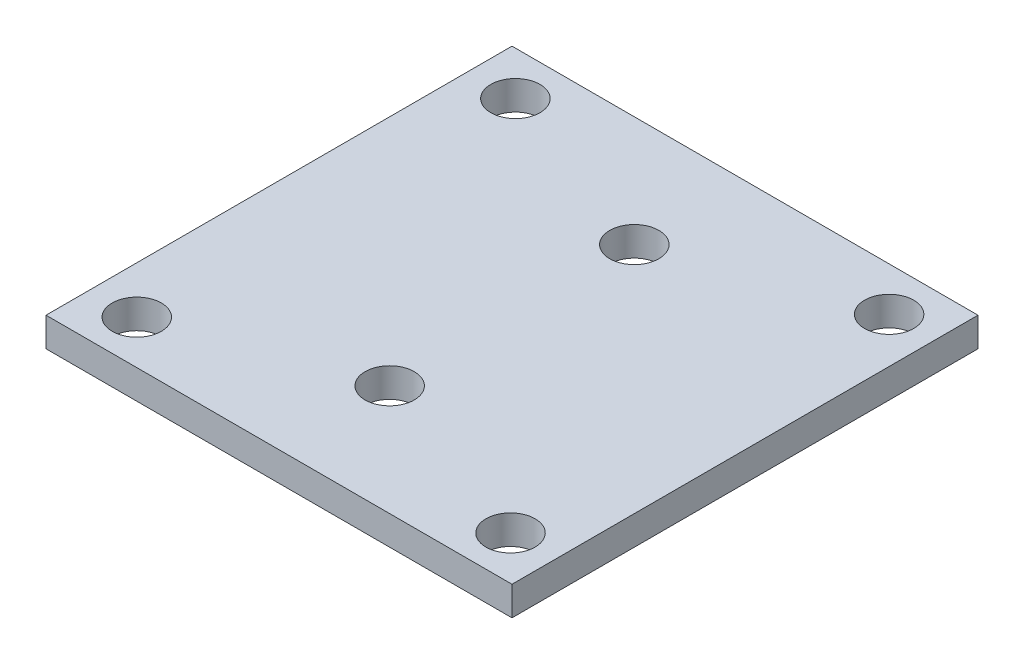
from build123d import *

# Parameters (mm, degrees)
SKETCH1_W               = 101.6
SKETCH1_H               = 101.6
BOSS_EXTRUDE1_DEPTH     = 6.35
F_1_2_13_TAPPED_HOLE1_D = 10.71626
F_1_2_13_TAPPED_HOLE2_D = 10.71626


with BuildPart() as part:
    # Sketch1 → Boss-Extrude1 (new body)
    with BuildSketch(Plane(origin=(0, 0, 0), x_dir=(1, 0, 0), z_dir=(0, 1, 0))):
        with Locations((50.8, 50.8)):
            Rectangle(SKETCH1_W, SKETCH1_H)
    extrude(amount=BOSS_EXTRUDE1_DEPTH)

    # 1/2-13 Tapped Hole1 (through all)
    with Locations(Plane(origin=(0, 6.35, 0), x_dir=(1, 0, 0), z_dir=(0, 1, 0))):
        with Locations((10.266147992, 92.075), (91.751726771, 9.525), (91.751726771, 92.075), (10.266147992, 9.525)):
            Hole(F_1_2_13_TAPPED_HOLE1_D / 2)

    # 1/2-13 Tapped Hole2 (through all)
    with Locations(Plane(origin=(0, 6.35, 0), x_dir=(1, 0, 0), z_dir=(0, 1, 0))):
        with Locations((50.8, 77.47), (50.8, 24.13)):
            Hole(F_1_2_13_TAPPED_HOLE2_D / 2)


solid = part.part
